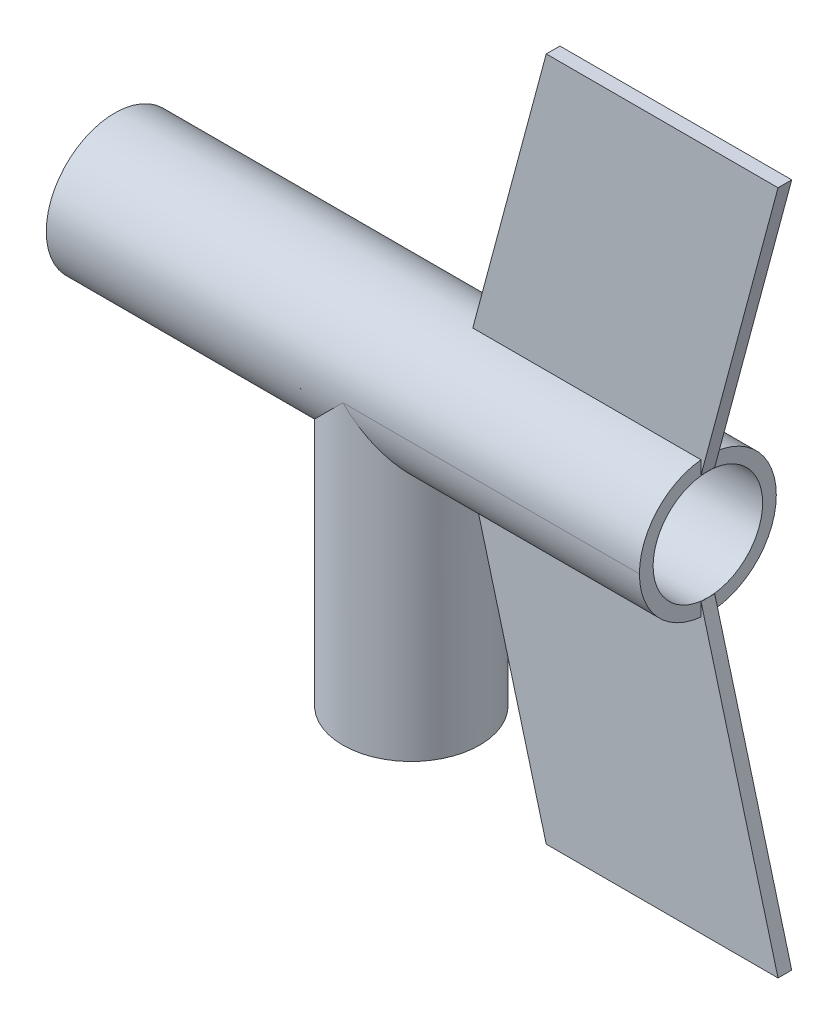
from build123d import *
from build123d.topology import SkipClean

# Parameters (mm, degrees)
SKETCH1_W                = 130
SKETCH1_H                = 15
SKETCH2_R                = 12
CUT_EXTRUDE1_DEPTH       = 135.257215821
EXTRUDE_THIN3_REACH      = 155.379
EXTRUDE_THIN3_END_RADIUS = 15
SKETCH3_R                = 15
SKETCH3_R_2              = 12
RIB3_START               = -1.5
RIB3_DEPTH               = 3
SKETCH6_R                = 7.675
SKETCH6_R_2              = 4.675
SKETCH6_W                = 3
SKETCH6_H                = 5.825
SKETCH6_W_2              = 5.825
SKETCH6_H_2              = 3
EXTRUDE_THIN4_DEPTH      = 5


with BuildPart() as part:
    # Sketch1 → Revolve2 (revolve)
    with BuildSketch(Plane.XY, mode=Mode.PRIVATE) as revolve2_sk:
        with Locations((65, 7.5)):
            Rectangle(SKETCH1_W, SKETCH1_H)
    revolve(revolve2_sk.sketch.rotate(Axis((-341.262273345, 15, 0), (1, 0, 0)), 270), axis=Axis((-341.262273345, 15, 0), (1, 0, 0)))

    # Sketch2 → Cut-Extrude1 (cut, through all)
    with BuildSketch(Plane(origin=(0, 0, 0), x_dir=(0, 0, -1), z_dir=(1, 0, 0))):
        with Locations((0, 15)):
            Circle(SKETCH2_R)
    extrude(amount=CUT_EXTRUDE1_DEPTH, mode=Mode.SUBTRACT)

    # Extrude-Thin3: up to this cylinder (the profile starts outside it)
    extrude_thin3_end = Plane(origin=(50.424264, 15, 0), z_dir=(-1, 0, 0)) * Cylinder(EXTRUDE_THIN3_END_RADIUS, 341.758, mode=Mode.PRIVATE)
    # Sketch3 → Extrude-Thin3 (add, up to the surface)
    with BuildSketch(Plane(origin=(0, -50, 0), x_dir=(1, 0, 0), z_dir=(0, 1, 0)), mode=Mode.PRIVATE) as extrude_thin3_sk1:
        with Locations((65, 0)):
            Circle(SKETCH3_R)
        with Locations((65, 0)):
            Circle(SKETCH3_R_2, mode=Mode.SUBTRACT)
    extrude_thin3_tool1 = extrude(extrude_thin3_sk1.sketch, amount=EXTRUDE_THIN3_REACH, mode=Mode.PRIVATE) - extrude_thin3_end
    add(extrude_thin3_tool1.solids().sort_by_distance((50.424264, -50, 0))[0])

    # Rib3: read off the stored shape, not the designer's step
    # Rib3 outline → Rib3 (add)
    with SkipClean():  # the faces are left unmerged after this step: merging them gives an invalid solid
        with BuildSketch(Plane.XY.offset(RIB3_START)):
            Polygon((146.880799123, -60), (130, 3), (130, 0.075188443), (79.979853317, 0.075188443), (96.076951546, -60), align=None)
        rib3 = extrude(amount=RIB3_DEPTH)

    # Mirror1: Rib3 across plane
    add(rib3.mirror(Plane.ZX.offset(15)))

    # Sketch6 → Extrude-Thin4 (add)
    # profile 1 of 5: a face of its own
    with BuildSketch(Plane(origin=(100, 0, 0), x_dir=(0, 0, -1), z_dir=(1, 0, 0))):
        with Locations((0, 15)):
            Circle(SKETCH6_R)
        with Locations((0, 15)):
            Circle(SKETCH6_R_2, mode=Mode.SUBTRACT)
    # profile 2 of 5: a face of its own
    with BuildSketch(Plane(origin=(100, 0, 0), x_dir=(0, 0, -1), z_dir=(1, 0, 0))):
        with Locations((0, 24.0875)):
            Rectangle(SKETCH6_W, SKETCH6_H)
    # profile 3 of 5: a face of its own
    with BuildSketch(Plane(origin=(100, 0, 0), x_dir=(0, 0, -1), z_dir=(1, 0, 0))):
        with Locations((9.0875, 15)):
            Rectangle(SKETCH6_W_2, SKETCH6_H_2)
    # profile 4 of 5: a face of its own
    with BuildSketch(Plane(origin=(100, 0, 0), x_dir=(0, 0, -1), z_dir=(1, 0, 0))):
        with Locations((-9.0875, 15)):
            Rectangle(SKETCH6_W_2, SKETCH6_H_2)
    # profile 5 of 5: a face of its own
    with BuildSketch(Plane(origin=(100, 0, 0), x_dir=(0, 0, -1), z_dir=(1, 0, 0))):
        with Locations((0, 5.9125)):
            Rectangle(SKETCH6_W, SKETCH6_H)
    extrude(amount=-EXTRUDE_THIN4_DEPTH)


solid = part.part
